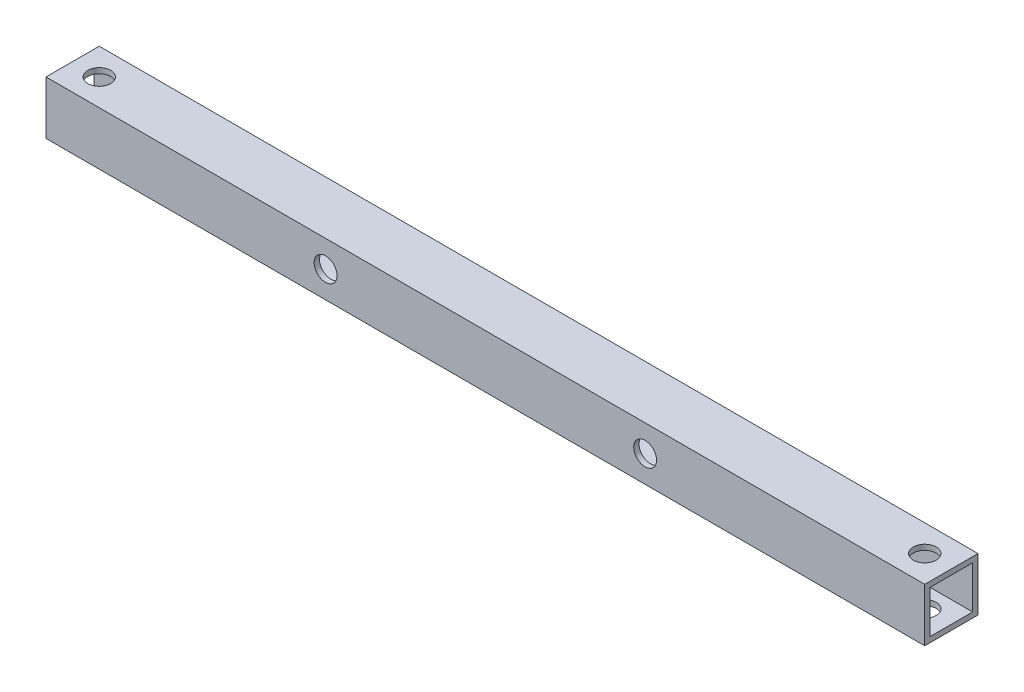
from build123d import *

# Parameters (mm, degrees)
SKETCH_1_W          = 10
SKETCH_1_H          = 10
SKETCH_1_W_2        = 8
SKETCH_1_H_2        = 8
EXTRUDE_1_DEPTH     = 165
SKETCH_3_R          = 2.15
CUT_EXTRUDE_1_DEPTH = 166.378354085
SKETCH_4_R          = 2.15
CUT_EXTRUDE_2_DEPTH = 166.378354085


with BuildPart() as part:
    # ｽｹｯﾁ1 → 押し出し-薄板1 (new body)
    with BuildSketch(Plane(origin=(0, 0, 0), x_dir=(0, 0, -1), z_dir=(1, 0, 0))):
        Rectangle(SKETCH_1_W, SKETCH_1_H)
        Rectangle(SKETCH_1_W_2, SKETCH_1_H_2, mode=Mode.SUBTRACT)
    extrude(amount=EXTRUDE_1_DEPTH)

    # ｽｹｯﾁ3 → ｶｯﾄ - 押し出し1 (cut, through all)
    with BuildSketch(Plane.XY.offset(5)):
        with Locations((52.5, 0)):
            Circle(SKETCH_3_R)
        with Locations((112.5, 0)):
            Circle(SKETCH_3_R)
    extrude(amount=-CUT_EXTRUDE_1_DEPTH, mode=Mode.SUBTRACT)

    # ｽｹｯﾁ4 → ｶｯﾄ - 押し出し2 (cut, through all)
    with BuildSketch(Plane(origin=(0, 5, 0), x_dir=(1, 0, 0), z_dir=(0, 1, 0))):
        with Locations((5, 0)):
            Circle(SKETCH_4_R)
        with Locations((160, 0)):
            Circle(SKETCH_4_R)
    extrude(amount=-CUT_EXTRUDE_2_DEPTH, mode=Mode.SUBTRACT)


solid = part.part
